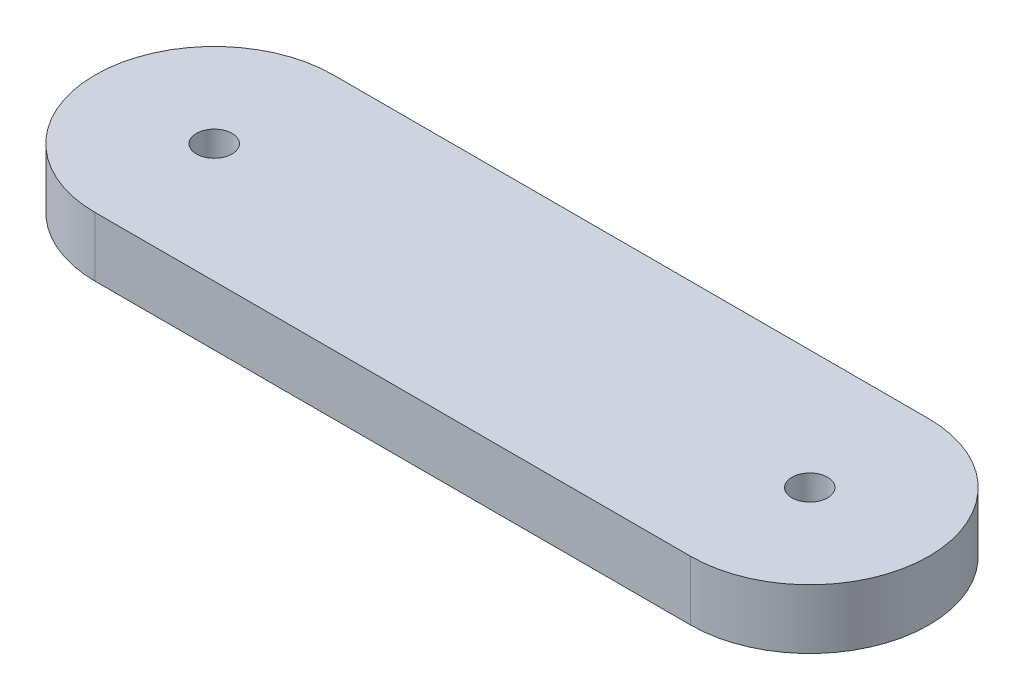
from build123d import *

# Parameters (mm, degrees)
BOSS_EXTRUDE1_DEPTH = 5
CUT_EXTRUDE1_REACH  = 38.742
SKETCH2_R           = 1.5


with BuildPart() as part:
    # Sketch1 → Boss-Extrude1 (new body)
    with BuildSketch(Plane(origin=(0, 0, 0), x_dir=(1, 0, 0), z_dir=(0, 1, 0))):
        with BuildLine():
            Line((-25, 10), (25, 10))
            ThreePointArc((25, 10), (35, 0), (25, -10))
            Line((25, -10), (-25, -10))
            ThreePointArc((-25, -10), (-35, 0), (-25, 10))
        make_face()
    extrude(amount=BOSS_EXTRUDE1_DEPTH)

    # Sketch2 → Cut-Extrude1 (cut, up to next)
    with BuildSketch(Plane(origin=(0, 5, 0), x_dir=(1, 0, 0), z_dir=(0, 1, 0)), mode=Mode.PRIVATE) as cut_extrude1_sk1:
        with Locations((-25, 0)):
            Circle(SKETCH2_R)
    cut_extrude1_tool1 = extrude(cut_extrude1_sk1.sketch, amount=-CUT_EXTRUDE1_REACH, mode=Mode.PRIVATE) & part.part
    # Sketch2 → Cut-Extrude1 (cut, up to next)
    with BuildSketch(Plane(origin=(0, 5, 0), x_dir=(1, 0, 0), z_dir=(0, 1, 0)), mode=Mode.PRIVATE) as cut_extrude1_sk2:
        with Locations((25, 0)):
            Circle(SKETCH2_R)
    cut_extrude1_tool2 = extrude(cut_extrude1_sk2.sketch, amount=-CUT_EXTRUDE1_REACH, mode=Mode.PRIVATE) & part.part
    add(cut_extrude1_tool1.solids().sort_by_distance((-25, 5, 0))[0], mode=Mode.SUBTRACT)
    add(cut_extrude1_tool2.solids().sort_by_distance((25, 5, 0))[0], mode=Mode.SUBTRACT)


solid = part.part
